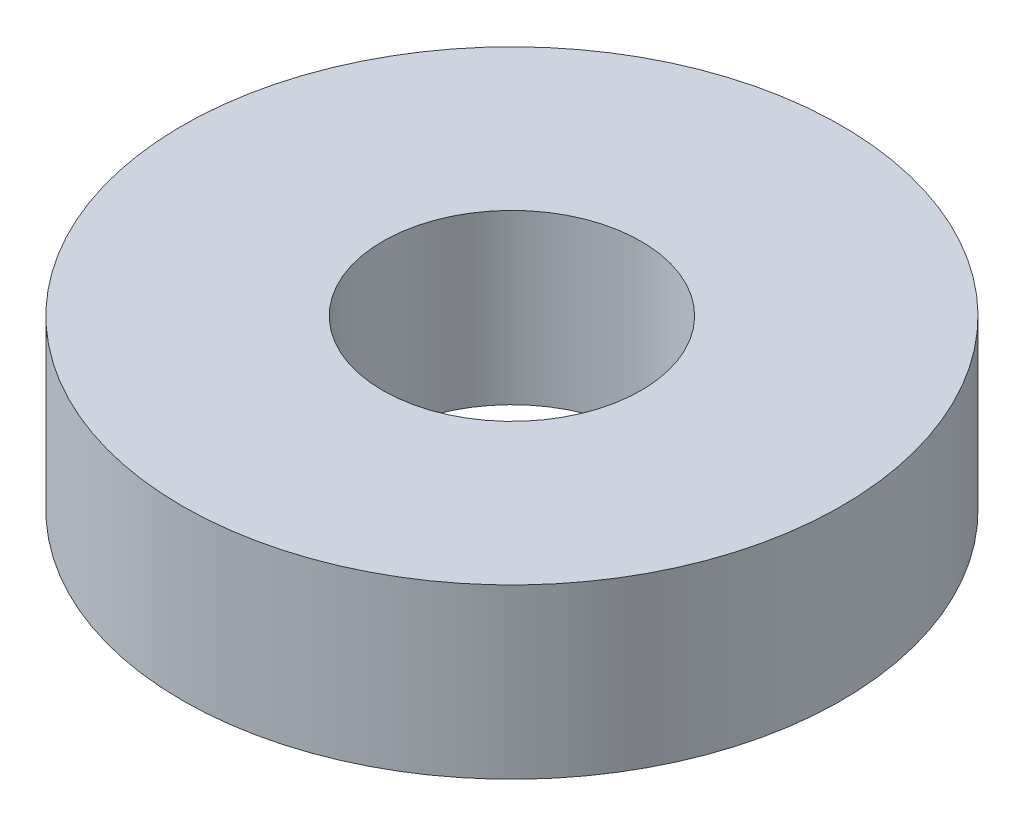
from build123d import *

# Parameters (mm, degrees)
SKETCH1_R           = 8.225
SKETCH1_R_2         = 3.225
BOSS_EXTRUDE1_DEPTH = 4.2


with BuildPart() as part:
    # Sketch1 → Boss-Extrude1 (new body)
    with BuildSketch(Plane(origin=(0, 0, 0), x_dir=(1, 0, 0), z_dir=(0, 1, 0))):
        Circle(SKETCH1_R)
        Circle(SKETCH1_R_2, mode=Mode.SUBTRACT)
    extrude(amount=BOSS_EXTRUDE1_DEPTH)


solid = part.part
